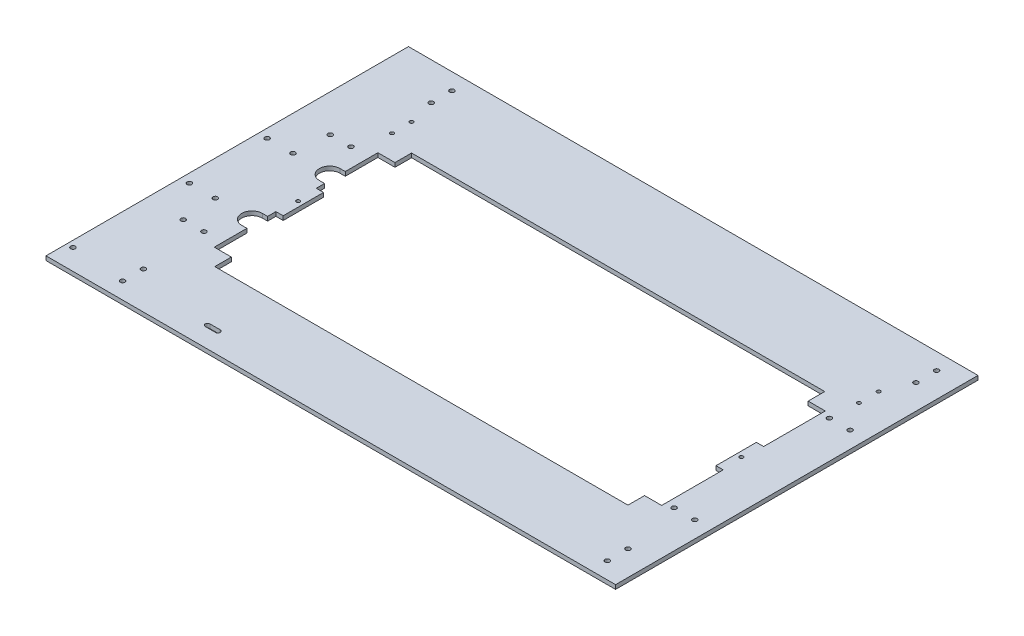
from build123d import *

# Parameters (mm, degrees)
SKETCH1_W           = 550
SKETCH1_H           = 350
SKETCH1_W_2         = 432
SKETCH1_H_2         = 158
BASE_FLANGE1_DEPTH  = 4
SKETCH4_W           = 399
SKETCH4_H           = 190
CUT_EXTRUDE1_DEPTH  = 343.669301222
SKETCH5_R           = 2.25
CUT_EXTRUDE2_DEPTH  = 343.669301222
SKETCH6_R           = 1.75
CUT_EXTRUDE3_DEPTH  = 343.669301222
SKETCH8_R           = 2.25
CUT_EXTRUDE5_DEPTH  = 343.669301222
SKETCH10_R          = 2.25
CUT_EXTRUDE7_DEPTH  = 343.669301222
SKETCH11_W          = 7
SKETCH11_H          = 39
TAB1_DEPTH          = 4
SKETCH12_R          = 1.75
CUT_EXTRUDE8_DEPTH  = 343.669301222
CUT_EXTRUDE9_DEPTH  = 343.669301222
SKETCH14_R          = 2.25
CUT_EXTRUDE10_DEPTH = 343.669301222


# Sheet-metal steps are written as plain solids
with BuildPart() as part:
    # Sketch1 → Base-Flange1 (new body)
    with BuildSketch(Plane(origin=(0, 0, 0), x_dir=(1, 0, 0), z_dir=(0, 1, 0))):
        with Locations((-15, 7.5)):
            Rectangle(SKETCH1_W, SKETCH1_H)
        Rectangle(SKETCH1_W_2, SKETCH1_H_2, mode=Mode.SUBTRACT)
    extrude(amount=-BASE_FLANGE1_DEPTH)

    # Sketch4 → Cut-Extrude1 (cut, through all)
    with BuildSketch(Plane(origin=(0, 0, 0), x_dir=(1, 0, 0), z_dir=(0, 1, 0))):
        Rectangle(SKETCH4_W, SKETCH4_H)
    extrude(amount=-CUT_EXTRUDE1_DEPTH, mode=Mode.SUBTRACT)

    # Sketch5 → Cut-Extrude2 (cut, through all)
    with BuildSketch(Plane.XZ.offset(4)):
        with Locations(Location((-254, 71, 0), (0, 0, 270))):
            Circle(SKETCH5_R)
        with Locations(Location((-234, 71, 0), (0, 0, 270))):
            Circle(SKETCH5_R)
        with Locations(Location((-234, -71, 0), (0, 0, 90))):
            Circle(SKETCH5_R)
        with Locations(Location((-254, -71, 0), (0, 0, 90))):
            Circle(SKETCH5_R)
        with Locations(Location((224, 75, 0), (0, 0, 270))):
            Circle(SKETCH5_R)
        with Locations(Location((244, 75, 0), (0, 0, 270))):
            Circle(SKETCH5_R)
        with Locations(Location((224, -75, 0), (0, 0, 90))):
            Circle(SKETCH5_R)
        with Locations(Location((244, -75, 0), (0, 0, 90))):
            Circle(SKETCH5_R)
    extrude(amount=-CUT_EXTRUDE2_DEPTH, mode=Mode.SUBTRACT)

    # Sketch6 → Cut-Extrude3 (cut, through all)
    with BuildSketch(Plane(origin=(0, 0, 0), x_dir=(1, 0, 0), z_dir=(0, 1, 0))):
        with Locations(Location((-225.5, 102, 0), (0, 0, 270))):
            Circle(SKETCH6_R)
        with Locations(Location((-225.5, 121, 0), (0, 0, 270))):
            Circle(SKETCH6_R)
        with Locations(Location((225.5, 102, 0), (0, 0, 90))):
            Circle(SKETCH6_R)
        with Locations(Location((225.5, 121, 0), (0, 0, 90))):
            Circle(SKETCH6_R)
    extrude(amount=-CUT_EXTRUDE3_DEPTH, mode=Mode.SUBTRACT)

    # Sketch8 → Cut-Extrude5 (cut, through all)
    with BuildSketch(Plane(origin=(0, 0, 0), x_dir=(1, 0, 0), z_dir=(0, 1, 0))):
        with Locations(Location((-232, 146.5, 0), (0, 0, 270))):
            Circle(SKETCH8_R)
        with Locations(Location((-232, 166.5, 0), (0, 0, 270))):
            Circle(SKETCH8_R)
        with Locations(Location((-232, -151.5, 0), (0, 0, 270))):
            Circle(SKETCH8_R)
        with Locations(Location((-232, -131.5, 0), (0, 0, 270))):
            Circle(SKETCH8_R)
        with Locations(Location((236, 146.5, 0), (0, 0, 270))):
            Circle(SKETCH8_R)
        with Locations(Location((236, 166.5, 0), (0, 0, 270))):
            Circle(SKETCH8_R)
        with Locations(Location((236, -151.5, 0), (0, 0, 270))):
            Circle(SKETCH8_R)
        with Locations(Location((236, -131.5, 0), (0, 0, 270))):
            Circle(SKETCH8_R)
    extrude(amount=-CUT_EXTRUDE5_DEPTH, mode=Mode.SUBTRACT)

    # Sketch10 → Cut-Extrude7 (cut, through all)
    with BuildSketch(Plane(origin=(0, 0, 0), x_dir=(1, 0, 0), z_dir=(0, 1, 0))):
        with Locations(Location((-284, -147.5, 0), (0, 0, 270))):
            Circle(SKETCH10_R)
        with BuildLine():
            Line((-154, -145.25), (-144, -145.25))
            ThreePointArc((-144, -145.25), (-141.75, -147.5), (-144, -149.75))
            Line((-144, -149.75), (-154, -149.75))
            ThreePointArc((-154, -149.75), (-156.25, -147.5), (-154, -145.25))
        make_face()
    extrude(amount=-CUT_EXTRUDE7_DEPTH, mode=Mode.SUBTRACT)

    # Sketch11 → Tab1 (add)
    with BuildSketch(Plane(origin=(0, 0, 0), x_dir=(1, 0, 0), z_dir=(0, 1, 0))):
        with Locations((-212.5, 0)):
            Rectangle(SKETCH11_W, SKETCH11_H)
        with Locations((212.5, 0)):
            Rectangle(SKETCH11_W, SKETCH11_H)
    extrude(amount=-TAB1_DEPTH)

    # Sketch12 → Cut-Extrude8 (cut, through all)
    with BuildSketch(Plane(origin=(0, 0, 0), x_dir=(1, 0, 0), z_dir=(0, 1, 0))):
        with Locations(Location((-214, 0, 0), (0, 0, 270))):
            Circle(SKETCH12_R)
        with Locations(Location((214, 0, 0), (0, 0, 270))):
            Circle(SKETCH12_R)
    extrude(amount=-CUT_EXTRUDE8_DEPTH, mode=Mode.SUBTRACT)

    # Sketch13 → Cut-Extrude9 (cut, through all)
    with BuildSketch(Plane(origin=(0, 0, 0), x_dir=(1, 0, 0), z_dir=(0, 1, 0))):
        with BuildLine():
            Line((-221, -27.5), (169.756928825, -27.5))
            ThreePointArc((169.756928825, -27.5), (179.756928825, -37.5), (169.756928825, -47.5))
            Line((169.756928825, -47.5), (-221, -47.5))
            ThreePointArc((-221, -47.5), (-231, -37.5), (-221, -27.5))
        make_face()
        with BuildLine():
            Line((-221, 27.5), (169.756928825, 27.5))
            ThreePointArc((169.756928825, 27.5), (179.756928825, 37.5), (169.756928825, 47.5))
            Line((169.756928825, 47.5), (-221, 47.5))
            ThreePointArc((-221, 47.5), (-231, 37.5), (-221, 27.5))
        make_face()
    extrude(amount=-CUT_EXTRUDE9_DEPTH, mode=Mode.SUBTRACT)

    # Sketch14 → Cut-Extrude10 (cut, through all)
    with BuildSketch(Plane(origin=(0, 0, 0), x_dir=(1, 0, 0), z_dir=(0, 1, 0))):
        with Locations(Location((-281.5, 37.5, 0), (0, 0, 270))):
            Circle(SKETCH14_R)
        with Locations(Location((-256.5, 37.5, 0), (0, 0, 270))):
            Circle(SKETCH14_R)
        with Locations(Location((-281.5, -37.5, 0), (0, 0, 270))):
            Circle(SKETCH14_R)
        with Locations(Location((-256.5, -37.5, 0), (0, 0, 270))):
            Circle(SKETCH14_R)
    extrude(amount=-CUT_EXTRUDE10_DEPTH, mode=Mode.SUBTRACT)


solid = part.part
